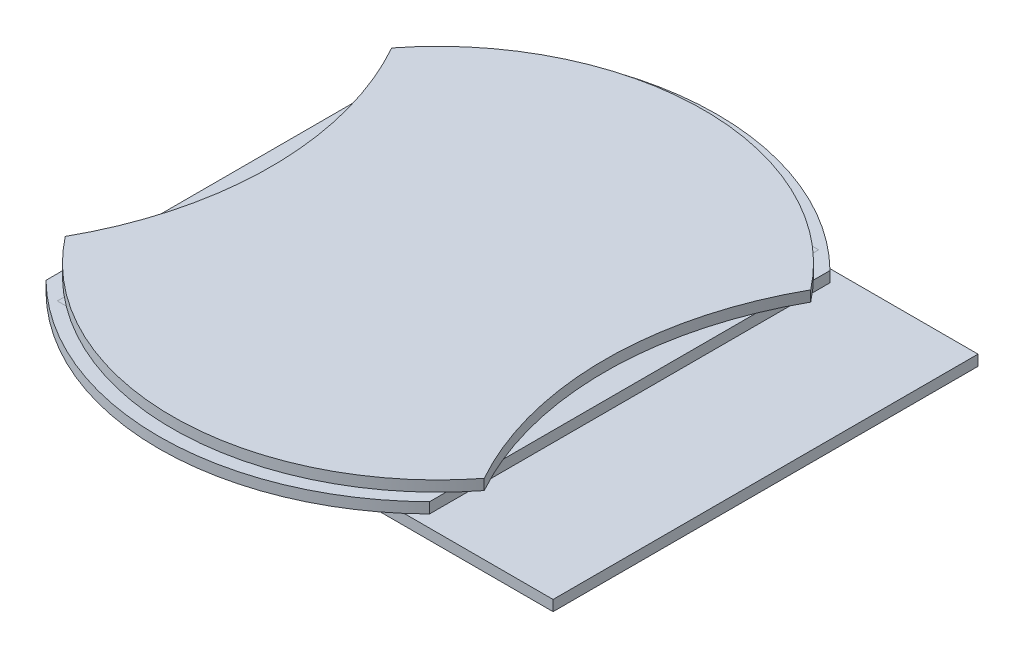
from build123d import *

# Parameters (mm, degrees)
SKETCH1_W                   = 140
SKETCH1_H                   = 120
COMPACT_DEPTH               = 3
SKETCH4_W                   = 95
SKETCH4_H                   = 120
SUPERCOMPACT_DEPTH          = 3
SKETCH7_R                   = 75
APPLE_BASE_DEPTH            = 3
SIDECUTS_DEPTH              = 195.694632694
APPLE_BASE_2_DEPTH          = 3
BOSS_EXTRUDE4_DEPTH         = 3
BASE_PLATE_FILLET_R         = 0.001
TOP_BOTTOM_EXTENSIONS_DEPTH = 3
SKETCH35_R                  = 1.25
SPACERHOLES_DEPTH           = 10
CUT_EXTRUDE4_DEPTH          = 10
SKETCH39_R                  = 1.5
CUT_EXTRUDE5_DEPTH          = 10
CUT_EXTRUDE6_START          = -3
CUT_EXTRUDE6_OUTLINE_R      = 1.5
CUT_EXTRUDE6_DEPTH          = 3
SKETCH41_R                  = 1.5
CUT_EXTRUDE7_DEPTH          = 10
SKETCH45_R                  = 1.5
CUT_EXTRUDE8_DEPTH          = 10


# Read off the part's stored shape, not the designer's step: Cut-Extrude6
with BuildPart() as part:
    # Sketch1 → Compact (new body)
    with BuildSketch(Plane(origin=(0, 0, 0), x_dir=(1, 0, 0), z_dir=(0, 1, 0))):
        with Locations((70, 60)):
            Rectangle(SKETCH1_W, SKETCH1_H)
    extrude(amount=COMPACT_DEPTH)


with BuildPart() as body_2:
    # Sketch4 → SuperCompact (new body)
    with BuildSketch(Plane(origin=(0, 3, 0), x_dir=(1, 0, 0), z_dir=(0, 1, 0))):
        with Locations((47.5, 60)):
            Rectangle(SKETCH4_W, SKETCH4_H)
    extrude(amount=SUPERCOMPACT_DEPTH)


with BuildPart() as body_3:
    # Sketch7 → Apple Base (new body)
    with BuildSketch(Plane(origin=(0, 6, 0), x_dir=(1, 0, 0), z_dir=(0, 1, 0))):
        with Locations(Location((47.5, 60, 0), (0, 0, 270))):
            Circle(SKETCH7_R)
    extrude(amount=APPLE_BASE_DEPTH)

    # Sketch8 → SideCuts (cut, through all)
    with BuildSketch(Plane(origin=(0, 9, 0), x_dir=(1, 0, 0), z_dir=(0, 1, 0))):
        with BuildLine():
            ThreePointArc((-11.66, 106.098746187), (0.350007958, 60), (-11.66, 13.901253813))
            ThreePointArc((-11.66, 13.901253813), (-27.5, 60), (-11.66, 106.098746187))
        make_face()
        with BuildLine():
            ThreePointArc((106.66, 106.098746187), (94.649992042, 60), (106.66, 13.901253813))
            ThreePointArc((106.66, 13.901253813), (122.5, 60), (106.66, 106.098746187))
        make_face()
    extrude(amount=-SIDECUTS_DEPTH, mode=Mode.SUBTRACT)


with BuildPart() as body_4:
    # Sketch9 → Apple_Base 2 (new body)
    with BuildSketch(Plane.XZ.offset(-6)):
        with BuildLine():
            ThreePointArc((106.66, -13.901253813), (47.5, 15), (-11.66, -13.901253813))
            ThreePointArc((-11.66, -13.901253813), (0.350007958, -60), (-11.66, -106.098746187))
            ThreePointArc((-11.66, -106.098746187), (47.5, -135), (106.66, -106.098746187))
            ThreePointArc((106.66, -106.098746187), (94.649992042, -60), (106.66, -13.901253813))
        make_face()
    extrude(amount=APPLE_BASE_2_DEPTH)

    # Sketch10 → Boss-Extrude4 (add)
    with BuildSketch(Plane(origin=(0, 6, 0), x_dir=(1, 0, 0), z_dir=(0, 1, 0))):
        with BuildLine():
            Line((-11.66, 106.098746187), (-11.66, 13.901253813))
            ThreePointArc((-11.66, 13.901253813), (0.350007958, 60), (-11.66, 106.098746187))
        make_face()
        with BuildLine():
            Line((106.66, 106.098746187), (106.66, 13.901253813))
            ThreePointArc((106.66, 13.901253813), (94.649992042, 60), (106.66, 106.098746187))
        make_face()
    extrude(amount=-BOSS_EXTRUDE4_DEPTH)

    # Base_Plate_Fillet
    base_plate_fillet_edges = [body_4.edges().sort_by_distance(p)[0] for p in [
        (-11.66, 3, -60),
        (-11.66, 6, -60),
        (47.5, 3, -135),
        (106.66, 3, -60),
        (106.66, 6, -60),
        (47.5, 6, -135),
        (47.5, 6, 15),
        (106.66, 4.5, -106.098746187),
        (-11.66, 4.5, -106.098746187),
        (-11.66, 4.5, -13.901253813),
        (106.66, 4.5, -13.901253813),
        (47.5, 3, 15),
    ]]
    fillet(base_plate_fillet_edges, radius=BASE_PLATE_FILLET_R)

    # Sketch25 → Top Bottom extensions (add)
    with BuildSketch(Plane(origin=(0, 6, 0), x_dir=(1, 0, 0), z_dir=(0, 1, 0))):
        with BuildLine():
            Line((-11.659005821, 106.097402592), (-11.659005821, 111.097402592))
            ThreePointArc((-11.659005821, 111.097402592), (47.5, 138.794628322), (106.659005821, 111.097402592))
            Line((106.659005821, 111.097402592), (106.659005821, 106.097402592))
            ThreePointArc((106.659005821, 106.097402592), (47.5, 133.794628322), (-11.659005821, 106.097402592))
        make_face()
        with BuildLine():
            Line((106.659005821, 13.902597408), (106.659005821, 8.902597408))
            ThreePointArc((106.659005821, 8.902597408), (47.5, -18.794628322), (-11.659005821, 8.902597408))
            Line((-11.659005821, 8.902597408), (-11.659005821, 13.902597408))
            ThreePointArc((-11.659005821, 13.902597408), (47.5, -13.794628322), (106.659005821, 13.902597408))
        make_face()
    extrude(amount=-TOP_BOTTOM_EXTENSIONS_DEPTH)

    # Sketch35 → SpacerHoles (cut)
    with BuildSketch(Plane.XZ.offset(-3)):
        with Locations(Location((7.5, -5.15, 0), (0, 0, 270))):
            Circle(SKETCH35_R)
        with Locations(Location((87.5, -5.15, 0), (0, 0, 270))):
            Circle(SKETCH35_R)
        with Locations(Location((87.5, -114.85, 0), (0, 0, 270))):
            Circle(SKETCH35_R)
        with Locations(Location((7.5, -114.85, 0), (0, 0, 270))):
            Circle(SKETCH35_R)
    extrude(amount=-SPACERHOLES_DEPTH, mode=Mode.SUBTRACT)

    # Sketch38 → Cut-Extrude4 (cut)
    with BuildSketch(Plane.XZ.offset(-3)):
        Polygon((47.5, 37.050137759), (120.372278362, 37.050137759), (120.372278362, -158.601845129), (-29.177494987, -158.601845129), (-29.177494987, 37.050137759), align=None)
        Polygon((-6.659, -60), (-6.659, 24.702355976), (101.659, 24.702355976), (101.659, -143.843523469), (-6.659, -143.843523469), align=None, mode=Mode.SUBTRACT)
    extrude(amount=-CUT_EXTRUDE4_DEPTH, mode=Mode.SUBTRACT)

    # Sketch39 → Cut-Extrude5 (cut)
    with BuildSketch(Plane.XZ.offset(-3)):
        with Locations(Location((7.5, -104.85, 0), (0, 0, 270))):
            Circle(SKETCH39_R)
        with Locations(Location((87.5, -104.85, 0), (0, 0, 270))):
            Circle(SKETCH39_R)
    extrude(amount=-CUT_EXTRUDE5_DEPTH, mode=Mode.SUBTRACT)

    # Cut-Extrude6 outline → Cut-Extrude6 (cut)
    with BuildSketch(Plane.XZ.offset(-3).offset(CUT_EXTRUDE6_START)):
        with Locations((15, -0.15)):
            Circle(CUT_EXTRUDE6_OUTLINE_R)
        with Locations((15, -119.85)):
            Circle(CUT_EXTRUDE6_OUTLINE_R)
        with Locations((80, -119.537367713)):
            Circle(CUT_EXTRUDE6_OUTLINE_R)
        with Locations((80, -89.037367713)):
            Circle(CUT_EXTRUDE6_OUTLINE_R)
        with Locations((80, -0.462632287)):
            Circle(CUT_EXTRUDE6_OUTLINE_R)
        with Locations((15, -30.65)):
            Circle(CUT_EXTRUDE6_OUTLINE_R)
        with Locations((80, -30.962632287)):
            Circle(CUT_EXTRUDE6_OUTLINE_R)
        with Locations((15, -89.35)):
            Circle(CUT_EXTRUDE6_OUTLINE_R)
    extrude(amount=CUT_EXTRUDE6_DEPTH, mode=Mode.SUBTRACT)

    # Sketch41 → Cut-Extrude7 (cut)
    with BuildSketch(Plane.XZ.offset(-3)):
        with Locations(Location((7.5, -15.15, 0), (0, 0, 270))):
            Circle(SKETCH41_R)
        with Locations(Location((87.459210086, -15.15, 0), (0, 0, 270))):
            Circle(SKETCH41_R)
    extrude(amount=-CUT_EXTRUDE7_DEPTH, mode=Mode.SUBTRACT)

    # Sketch45 → Cut-Extrude8 (cut)
    with BuildSketch(Plane(origin=(0, 6, 0), x_dir=(1, 0, 0), z_dir=(0, 1, 0))):
        with Locations(Location((77.5, 70, 0), (0, 0, 270))):
            Circle(SKETCH45_R)
        with Locations(Location((17.5, 70, 0), (0, 0, 270))):
            Circle(SKETCH45_R)
        with Locations(Location((17.5, 50, 0), (0, 0, 270))):
            Circle(SKETCH45_R)
        with Locations(Location((77.5, 50, 0), (0, 0, 270))):
            Circle(SKETCH45_R)
    extrude(amount=-CUT_EXTRUDE8_DEPTH, mode=Mode.SUBTRACT)


solid = Compound([part.part, body_2.part, body_3.part, body_4.part])
